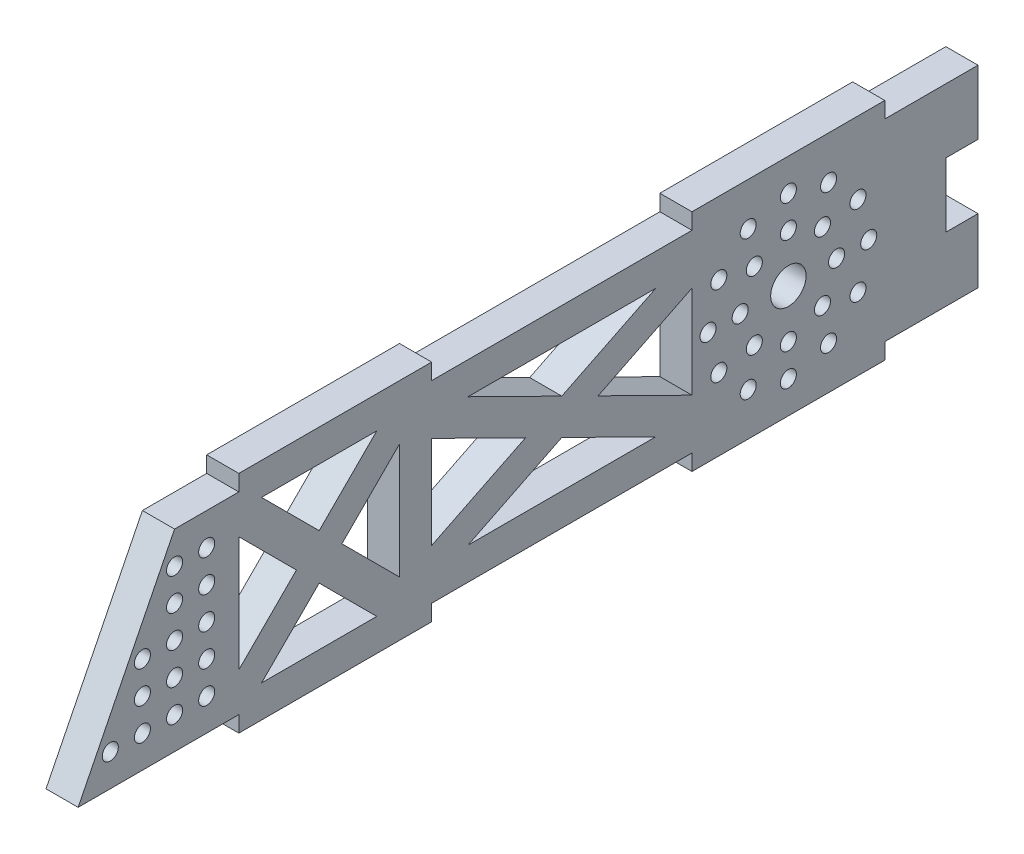
from build123d import *

# Parameters (mm, degrees)
SKETCH1_W               = 355.6
SKETCH1_H               = 76.2
BOSS_EXTRUDE1_DEPTH     = 12.7
CUT_EXTRUDE1_DEPTH      = 183.279291199
CUT_EXTRUDE1_DEPTH_BACK = 183.279291199
SKETCH3_W               = 76.2
SKETCH3_H               = 6.35
BOSS_EXTRUDE2_DEPTH     = 12.7
SKETCH4_W               = 12.7
SKETCH4_H               = 25.4
CUT_EXTRUDE2_DEPTH      = 184.711546997
SKETCH5_R               = 7
CUT_EXTRUDE3_DEPTH      = 184.711546997
CUT_EXTRUDE4_DEPTH      = 184.711546997
SKETCH7_R               = 3.175
CUT_EXTRUDE5_DEPTH      = 184.711546997


with BuildPart() as part:
    # Sketch1 → Boss-Extrude1 (new body)
    with BuildSketch(Plane(origin=(0, 0, 0), x_dir=(0, 0, -1), z_dir=(1, 0, 0))):
        Rectangle(SKETCH1_W, SKETCH1_H)
    extrude(amount=BOSS_EXTRUDE1_DEPTH)

    # Sketch2 → Cut-Extrude1 (cut, two sides: drawn at the far end of the back side and taken through both)
    with BuildSketch(Plane(origin=(12.7, 0, 0), x_dir=(0, 0, -1), z_dir=(1, 0, 0)).offset(-CUT_EXTRUDE1_DEPTH_BACK)):
        Polygon((-507.550847217, -697.601694433), (-177.8, -38.1), (-139.7, 38.1), (190.050847217, 697.601694433), (-1128.95254165, 1357.103388866), (-1826.554236083, -38.1), align=None)
    extrude(amount=CUT_EXTRUDE1_DEPTH + CUT_EXTRUDE1_DEPTH_BACK, mode=Mode.SUBTRACT)

    # Sketch3 → Boss-Extrude2 (add)
    with BuildSketch(Plane.ZY):
        with Locations((-102.87, -41.275)):
            Rectangle(SKETCH3_W, SKETCH3_H)
        with Locations((76.2, -41.275)):
            Rectangle(SKETCH3_W, SKETCH3_H)
        with Locations((-102.87, 41.275)):
            Rectangle(SKETCH3_W, SKETCH3_H)
        with Locations((76.2, 41.275)):
            Rectangle(SKETCH3_W, SKETCH3_H)
    extrude(amount=-BOSS_EXTRUDE2_DEPTH)

    # Sketch4 → Cut-Extrude2 (cut, through all)
    with BuildSketch(Plane.ZY):
        with Locations((-171.45, 0)):
            Rectangle(SKETCH4_W, SKETCH4_H)
    extrude(amount=-CUT_EXTRUDE2_DEPTH, mode=Mode.SUBTRACT)

    # Sketch5 → Cut-Extrude3 (cut, through all)
    with BuildSketch(Plane.ZY):
        with Locations((-102.87, 0)):
            Circle(SKETCH5_R)
    extrude(amount=-CUT_EXTRUDE3_DEPTH, mode=Mode.SUBTRACT)

    # Sketch6 → Cut-Extrude4 (cut, through all)
    with BuildSketch(Plane.ZY):
        Polygon((23.758802297, 25.4), (-50.428802297, 25.4), (-13.335, 7.08207294), align=None)
        Polygon((-27.676197703, 0), (-64.77, 18.31792706), (-64.77, -18.31792706), align=None)
        Polygon((38.1, -18.31792706), (38.1, 18.31792706), (1.006197703, 0), align=None)
        Polygon((-13.335, -7.08207294), (-50.428802297, -25.4), (23.758802297, -25.4), align=None)
        Polygon((105.319743879, 31.75), (59.780256121, 31.75), (82.55, 8.980256121), align=None)
        Polygon((73.569743879, 0), (50.8, 22.769743879), (50.8, -22.769743879), align=None)
        Polygon((114.3, 22.769743879), (91.530256121, 0), (114.3, -22.769743879), align=None)
        Polygon((105.319743879, -31.75), (82.55, -8.980256121), (59.780256121, -31.75), align=None)
    extrude(amount=-CUT_EXTRUDE4_DEPTH, mode=Mode.SUBTRACT)

    # Sketch7 → Cut-Extrude5 (cut, through all)
    with BuildSketch(Plane(origin=(12.7, 0, 0), x_dir=(0, 0, -1), z_dir=(1, 0, 0))):
        with Locations((121.92, 0)):
            Circle(SKETCH7_R)
        with Locations((134.62, 0)):
            Circle(SKETCH7_R)
        with Locations((116.340384182, -13.470384182)):
            Circle(SKETCH7_R)
        with Locations((102.87, -19.05)):
            Circle(SKETCH7_R)
        with Locations((89.399615818, -13.470384182)):
            Circle(SKETCH7_R)
        with Locations((83.82, 0)):
            Circle(SKETCH7_R)
        with Locations((89.399615818, 13.470384182)):
            Circle(SKETCH7_R)
        with Locations((102.87, 19.05)):
            Circle(SKETCH7_R)
        with Locations((116.340384182, 13.470384182)):
            Circle(SKETCH7_R)
        with Locations((130.36630657, -15.875)):
            Circle(SKETCH7_R)
        with Locations((118.745, -27.49630657)):
            Circle(SKETCH7_R)
        with Locations((102.87, -31.75)):
            Circle(SKETCH7_R)
        with Locations((86.995, -27.49630657)):
            Circle(SKETCH7_R)
        with Locations((75.37369343, -15.875)):
            Circle(SKETCH7_R)
        with Locations((71.12, 0)):
            Circle(SKETCH7_R)
        with Locations((75.37369343, 15.875)):
            Circle(SKETCH7_R)
        with Locations((86.995, 27.49630657)):
            Circle(SKETCH7_R)
        with Locations((102.87, 31.75)):
            Circle(SKETCH7_R)
        with Locations((118.745, 27.49630657)):
            Circle(SKETCH7_R)
        with Locations((130.36630657, 15.875)):
            Circle(SKETCH7_R)
        with Locations((-127, 25.4)):
            Circle(SKETCH7_R)
        with Locations((-127, 12.7)):
            Circle(SKETCH7_R)
        with Locations((-127, 0)):
            Circle(SKETCH7_R)
        with Locations((-127, -12.7)):
            Circle(SKETCH7_R)
        with Locations((-127, -25.4)):
            Circle(SKETCH7_R)
        with Locations((-139.7, 12.7)):
            Circle(SKETCH7_R)
        with Locations((-139.7, 0)):
            Circle(SKETCH7_R)
        with Locations((-139.7, -12.7)):
            Circle(SKETCH7_R)
        with Locations((-139.7, -25.4)):
            Circle(SKETCH7_R)
        with Locations((-152.4, 0)):
            Circle(SKETCH7_R)
        with Locations((-152.4, -12.7)):
            Circle(SKETCH7_R)
        with Locations((-152.4, -25.4)):
            Circle(SKETCH7_R)
        with Locations((-165.1, -25.4)):
            Circle(SKETCH7_R)
        with Locations((-139.7, 25.4)):
            Circle(SKETCH7_R)
    extrude(amount=-CUT_EXTRUDE5_DEPTH, mode=Mode.SUBTRACT)


solid = part.part
